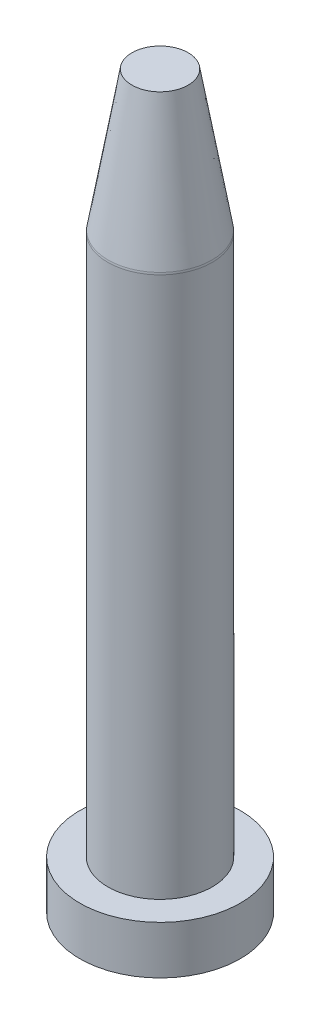
from build123d import *

# Parameters (mm, degrees)
FILLET_1_R = 3


with BuildPart() as part:
    # 草图1 → Revolve 297 (revolve)
    with BuildSketch(Plane.XY):
        Polygon((0, 0), (20, 0), (20, 12), (13, 12), (13, 147), (7, 182), (0, 182), align=None)
    revolve(axis=Axis((0, 0, 0), (0, 1, 0)))

    # 圆角1
    fillet_1_edges = [part.edges().sort_by_distance(p)[0] for p in [
        (-13, 147, 0),
    ]]
    fillet(fillet_1_edges, radius=FILLET_1_R)


solid = part.part
